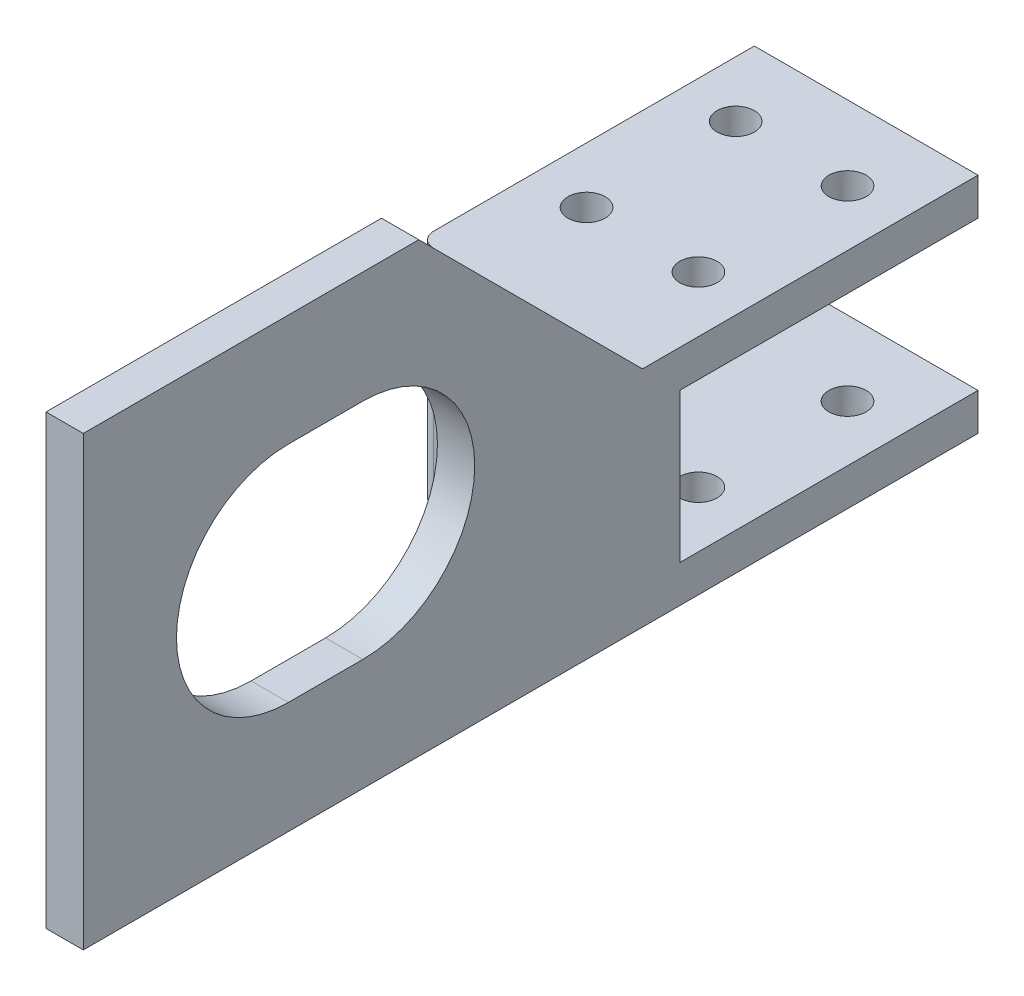
from build123d import *

# Parameters (mm, degrees)
BOSS_EXTRUDE1_DEPTH      = 15
SKETCH2_W                = 5
SKETCH2_H                = 60
BOSS_EXTRUDE2_DEPTH      = 75
CHAMFER1_SIZE            = 30
CHAMFER1_OF_MIRROR1_SIZE = 30
CUT_EXTRUDE3_DEPTH       = 113.472218792
CUT_EXTRUDE4_DEPTH       = 114.688170009
FILLET3_R                = 5
FILLET4_R                = 2
CUT_EXTRUDE6_DEPTH       = 106.475115549
CUT_EXTRUDE6_DEPTH_BACK  = 106.475115549
SKETCH8_R                = 2.5


# Some blends are built 0.0001 mm under size
with BuildPart() as part:
    # Sketch1 → Boss-Extrude1 (new, symmetric)
    with BuildSketch(Plane(origin=(0, 0, 0), x_dir=(0, 0, -1), z_dir=(1, 0, 0))):
        Polygon((20, 10), (-20, 10), (-20, -10), (20, -10), (20, -15), (-25, -15), (-25, 15), (20, 15), align=None)
    extrude(amount=BOSS_EXTRUDE1_DEPTH, both=True)

    # Sketch2 → Boss-Extrude2 (add)
    with BuildSketch(Plane.XY.offset(25)):
        with Locations((-12.5, 15)):
            Rectangle(SKETCH2_W, SKETCH2_H)
    boss_extrude2 = extrude(amount=BOSS_EXTRUDE2_DEPTH)

    # Chamfer1
    chamfer1_edges = [part.edges().sort_by_distance(p)[0] for p in [
        (-12.5, 45, 25),
    ]]
    chamfer(chamfer1_edges, length=CHAMFER1_SIZE - 0.0001)  # a hair under: the kernel refuses the full size

    # Mirror1: Boss-Extrude2 across plane
    add(boss_extrude2.mirror(Plane(origin=(0, 0, 0), x_dir=(0, 0, 1), z_dir=(1, 0, 0))))

    # Chamfer1 of Mirror1
    chamfer1_of_mirror1_edges = [part.edges().sort_by_distance(p)[0] for p in [
        (12.5, 45, 25),
    ]]
    chamfer(chamfer1_of_mirror1_edges, length=CHAMFER1_OF_MIRROR1_SIZE - 0.0001)  # a hair under: the kernel refuses the full size

    # Sketch5 → Cut-Extrude3 (cut, through all)
    with BuildSketch(Plane(origin=(-10, 0, 0), x_dir=(0, 0, -1), z_dir=(1, 0, 0))):
        Polygon((-25, -15), (-25, 15), (-55, 45), (-100, 45), (-100, -15), align=None)
    extrude(amount=-CUT_EXTRUDE3_DEPTH, mode=Mode.SUBTRACT)

    # Sketch6 → Cut-Extrude4 (cut, through all)
    with BuildSketch(Plane(origin=(15, 0, 0), x_dir=(0, 0, -1), z_dir=(1, 0, 0))):
        with BuildLine():
            Line((-62.5, 0), (-72.5, 0))
            ThreePointArc((-72.5, 0), (-87.5, 15), (-72.5, 30))
            Line((-72.5, 30), (-62.5, 30))
            ThreePointArc((-62.5, 30), (-47.5, 15), (-62.5, 0))
        make_face()
    extrude(amount=-CUT_EXTRUDE4_DEPTH, mode=Mode.SUBTRACT)

    # Fillet3
    # the kernel refuses this fillet: 5 mm, written as the material it adds along each edge
    with BuildSketch(Plane(origin=(10, 27.5, 25), x_dir=(0, 0, 1), z_dir=(0, -1, 0))) as fillet3_piece_1_section:
        with BuildLine():
            CenterArc((FILLET3_R, FILLET3_R), FILLET3_R, 180, 90)
            Line((0, FILLET3_R), (0, 0))
            Line((0, 0), (FILLET3_R, 0))
        make_face()
    fillet3_piece_1 = extrude(amount=42.5, mode=Mode.PRIVATE)
    fillet3_piece_1 = split(fillet3_piece_1, bisect_by=Plane(origin=(9.467598147, 16.61296207, 26.61286207), z_dir=(0, -0.7071067811865476, 0.7071067811865476)), keep=Keep.TOP, mode=Mode.PRIVATE)
    fillet3_piece_1 = split(fillet3_piece_1, bisect_by=Plane(origin=(9.467598147, 15, 27.150516093), z_dir=(0, 1, 0)), keep=Keep.TOP, mode=Mode.PRIVATE)
    add(fillet3_piece_1)
    with BuildSketch(Plane(origin=(10, 15, 25), x_dir=(0, 0, 1), z_dir=(0, -1, 0))) as fillet3_piece_2_section:
        with BuildLine():
            CenterArc((FILLET3_R, FILLET3_R), FILLET3_R, 180, 90)
            Line((0, FILLET3_R), (0, 0))
            Line((0, 0), (FILLET3_R, 0))
        make_face()
    fillet3_piece_2 = extrude(amount=30, mode=Mode.PRIVATE)
    fillet3_piece_2 = split(fillet3_piece_2, bisect_by=Plane(origin=(8.982634351, 0, 25), z_dir=(0, 0, 1)), keep=Keep.TOP, mode=Mode.PRIVATE)
    add(fillet3_piece_2)

    # Fillet4
    fillet4_edges = [part.edges().sort_by_distance(p)[0] for p in [
        (-15, 0, 25),
    ]]
    fillet(fillet4_edges, radius=FILLET4_R)

    # Sketch8 → Cut-Extrude6 (cut, two sides: drawn at the far end of the back side and taken through both)
    with BuildSketch(Plane(origin=(0, 15, 0), x_dir=(1, 0, 0), z_dir=(0, 1, 0)).offset(-CUT_EXTRUDE6_DEPTH_BACK)):
        with Locations(Location((-7.5, -10, 0), (0, 0, 270))):
            Circle(SKETCH8_R)
        with Locations(Location((7.5, -10, 0), (0, 0, 270))):
            Circle(SKETCH8_R)
        with Locations(Location((-7.5, 10, 0), (0, 0, 270))):
            Circle(SKETCH8_R)
        with Locations(Location((7.5, 10, 0), (0, 0, 270))):
            Circle(SKETCH8_R)
    extrude(amount=CUT_EXTRUDE6_DEPTH + CUT_EXTRUDE6_DEPTH_BACK, mode=Mode.SUBTRACT)


solid = part.part
